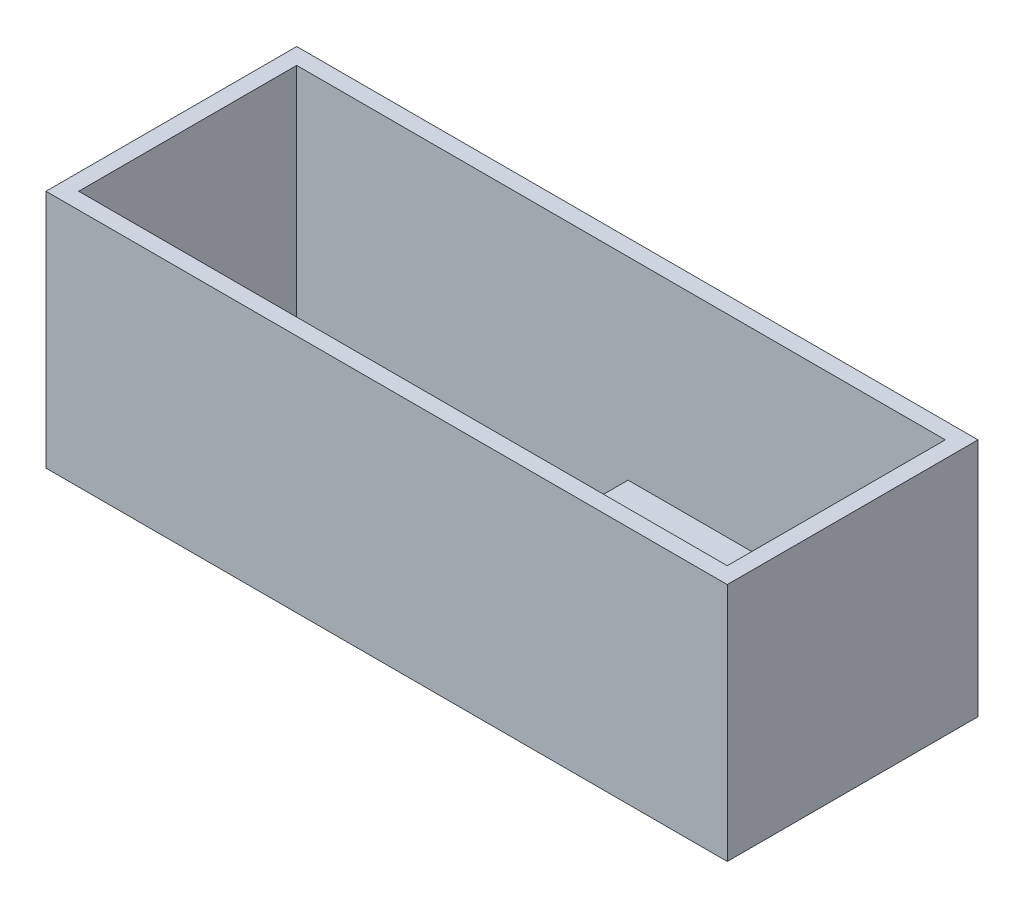
from build123d import *

# Parameters (mm, degrees)
SKETCH1_W           = 119
SKETCH1_H           = 40
BOSS_EXTRUDE1_DEPTH = 4
SKETCH2_W           = 125
SKETCH2_H           = 46
SKETCH2_W_2         = 119
SKETCH2_H_2         = 40
BOSS_EXTRUDE2_DEPTH = 44
SKETCH3_W           = 58.2
SKETCH3_H           = 40
BOSS_EXTRUDE3_DEPTH = 3
SKETCH4_W           = 28
SKETCH4_H           = 40
BOSS_EXTRUDE4_DEPTH = 1.5
SKETCH5_R           = 4
BOSS_EXTRUDE5_DEPTH = 12
SKETCH6_R           = 11
CUT_EXTRUDE1_DEPTH  = 3


with BuildPart() as part:
    # Sketch1 → Boss-Extrude1 (new body)
    with BuildSketch(Plane(origin=(0, 0, 0), x_dir=(1, 0, 0), z_dir=(0, 1, 0))):
        Rectangle(SKETCH1_W, SKETCH1_H)
    extrude(amount=BOSS_EXTRUDE1_DEPTH)

    # Sketch2 → Boss-Extrude2 (add)
    with BuildSketch(Plane(origin=(0, 0, 0), x_dir=(1, 0, 0), z_dir=(0, 1, 0))):
        Rectangle(SKETCH2_W, SKETCH2_H)
        Rectangle(SKETCH2_W_2, SKETCH2_H_2, mode=Mode.SUBTRACT)
    extrude(amount=BOSS_EXTRUDE2_DEPTH)

    # Sketch3 → Boss-Extrude3 (add)
    with BuildSketch(Plane(origin=(0, 4, 0), x_dir=(1, 0, 0), z_dir=(0, 1, 0))):
        with Locations((30.4, 0)):
            Rectangle(SKETCH3_W, SKETCH3_H)
    extrude(amount=BOSS_EXTRUDE3_DEPTH)

    # Sketch4 → Boss-Extrude4 (add)
    with BuildSketch(Plane(origin=(0, 7, 0), x_dir=(1, 0, 0), z_dir=(0, 1, 0))):
        with Locations((15.3, 0)):
            Rectangle(SKETCH4_W, SKETCH4_H)
    extrude(amount=BOSS_EXTRUDE4_DEPTH)

    # Sketch5 → Boss-Extrude5 (add)
    with BuildSketch(Plane.XZ):
        with Locations((39.5, 0)):
            Circle(SKETCH5_R)
    extrude(amount=BOSS_EXTRUDE5_DEPTH)

    # Sketch6 → Cut-Extrude1 (cut)
    with BuildSketch(Plane.XZ):
        with Locations((39.5, 0)):
            Circle(SKETCH6_R)
    extrude(amount=-CUT_EXTRUDE1_DEPTH, mode=Mode.SUBTRACT)


with BuildPart() as cut_extrude1_piece_1:
    # of the separate pieces the step leaves, piece 1, a body of its own (cut_extrude1_pieces)
    add(part.part.solids().sort_by_distance((-62.5, 0, 23))[0])


with BuildPart() as cut_extrude1_piece_2:
    # of the separate pieces the step leaves, piece 2, a body of its own (cut_extrude1_pieces)
    add(part.part.solids().sort_by_distance((43.5, 0, 0))[0])


solid = Compound([cut_extrude1_piece_1.part, cut_extrude1_piece_2.part])
